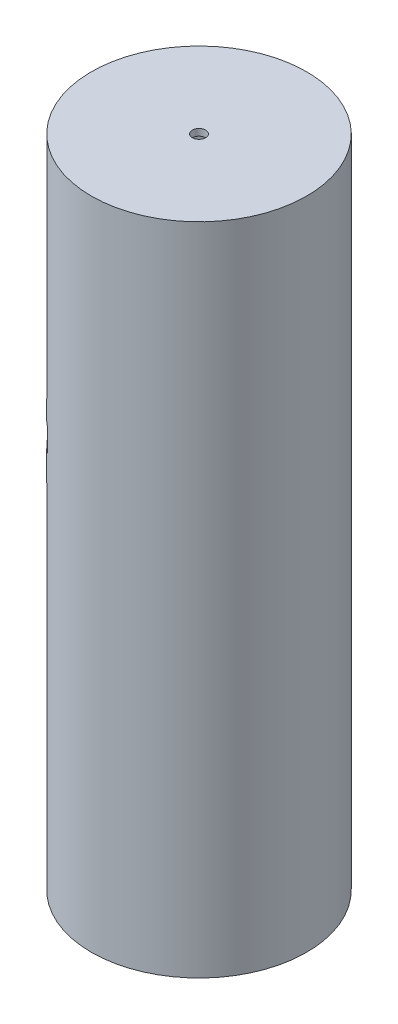
from build123d import *
from build123d.topology import SkipClean

# Parameters (mm, degrees)
SKETCH1_R           = 48.5
SKETCH1_R_2         = 46
BOSS_EXTRUDE1_DEPTH = 295
BOSS_EXTRUDE2_START = -148.568038
SKETCH3_R           = 46
BOSS_EXTRUDE2_DEPTH = 6
CIRPATTERN1_COUNT   = 4
FILLET2_START       = 156.431961757
FILLET2_OUTLINE_R   = 46
FILLET2_DEPTH       = 5.0000001
FILLET2_START_2     = 167.431961857
FILLET2_2_OUTLINE_R = 46
FILLET2_2_DEPTH     = 5.0000001
FILLET2_START_3     = 160.260971941
FILLET2_4_DEPTH     = 8.341979732
FILLET2_START_4     = 161.431961857
FILLET2_5_DEPTH     = 6
SKETCH4_R           = 2.551704147
BOSS_EXTRUDE3_DEPTH = 10
SKETCH5_R           = 1.6
CUT_EXTRUDE1_DEPTH  = 1.6
BOSS_EXTRUDE4_START = -3
SKETCH6_R           = 48.5
BOSS_EXTRUDE4_DEPTH = 3
FILLET3_R           = 10
SKETCH7_R           = 3
CUT_EXTRUDE2_DEPTH  = 3
SKETCH9_W           = 32.917963655
SKETCH9_H           = 10.655653456
CUT_EXTRUDE3_DEPTH  = 22


with BuildPart() as part:
    # Sketch1 → Boss-Extrude1 (new body)
    with BuildSketch(Plane(origin=(0, 15, 0), x_dir=(1, 0, 0), z_dir=(0, 1, 0))):
        with Locations(Location((0, 0, 0), (0, 0, 270))):
            Circle(SKETCH1_R)
        with Locations(Location((0, 0, 0), (0, 0, 270))):
            Circle(SKETCH1_R_2, mode=Mode.SUBTRACT)
    extrude(amount=BOSS_EXTRUDE1_DEPTH)

    # Sketch3 → Boss-Extrude2 (add)
    with BuildSketch(Plane(origin=(0, 310, 0), x_dir=(1, 0, 0), z_dir=(0, 1, 0)).offset(BOSS_EXTRUDE2_START)):
        with Locations(Location((0, 0, 0), (0, 0, 270))):
            Circle(SKETCH3_R)
        with BuildLine():
            Line((-29.674213133, 25.15301941), (-34.621942216, 27.501293009))
            ThreePointArc((-34.621942216, 27.501293009), (39.944695621, -18.958409524), (-43.197423731, 9.433057988))
            Line((-43.197423731, 9.433057988), (-38.249694648, 7.084784388))
            Line((-38.249694648, 7.084784388), (-36.963372421, 9.795019642))
            Line((-36.963372421, 9.795019642), (-42.380223803, 12.3659464))
            ThreePointArc((-42.380223803, 12.3659464), (-41.607558546, 14.758423758), (-40.699952451, 17.103036878))
            Line((-40.699952451, 17.103036878), (-36.002135032, 14.873375465))
            Line((-36.002135032, 14.873375465), (-34.287038729, 18.487022469))
            Line((-34.287038729, 18.487022469), (-38.984856148, 20.716683883))
            ThreePointArc((-38.984856148, 20.716683883), (-37.742324037, 22.902335607), (-36.377386743, 25.013710915))
            Line((-36.377386743, 25.013710915), (-30.960535361, 22.442784157))
            Line((-30.960535361, 22.442784157), (-29.674213133, 25.15301941))
        make_face(mode=Mode.SUBTRACT)
    boss_extrude2 = extrude(amount=BOSS_EXTRUDE2_DEPTH)

    # CirPattern1: Boss-Extrude2 ×4 about axis
    cirpattern1_axis = Axis((0, 0, 0), (0, 1, 0))
    for i in range(1, CIRPATTERN1_COUNT):
        add(boss_extrude2.rotate(cirpattern1_axis, i * 360 / CIRPATTERN1_COUNT))

    # Fillet2: read off the stored shape, not the designer's step
    # Fillet2 outline → Fillet2 (add)
    with BuildSketch(Plane(origin=(0, 0, 0), x_dir=(1, 0, 0), z_dir=(0, 1, 0)).offset(FILLET2_START)):
        Circle(FILLET2_OUTLINE_R)
    extrude(amount=FILLET2_DEPTH)

    # Fillet2 2 outline → Fillet2 2 (add)
    with BuildSketch(Plane(origin=(0, 0, 0), x_dir=(1, 0, 0), z_dir=(0, 1, 0)).offset(FILLET2_START_2)):
        Circle(FILLET2_2_OUTLINE_R)
    extrude(amount=FILLET2_2_DEPTH)

    # Fillet2 3 outline → Fillet2 3 (revolve, cut)
    with BuildSketch(Plane.XY):
        with BuildLine():
            ThreePointArc((46, 156.431961857), (44.535533906, 159.967495763), (41, 161.431961857))
            Line((41, 161.431961857), (41, 167.431961857))
            ThreePointArc((41, 167.431961857), (44.535533906, 168.896427951), (46, 172.431961857))
            Line((46, 172.431961857), (0, 172.431961857))
            Line((0, 172.431961857), (0, 156.431961857))
            Line((0, 156.431961857), (46, 156.431961857))
        make_face()
    revolve(axis=Axis((0, 0, 0), (0, 1, 0)), mode=Mode.SUBTRACT)

    # Fillet2 4 outline → Fillet2 4 (cut)
    with SkipClean():  # the faces are left unmerged after this step: merging them gives an invalid solid
        with BuildSketch(Plane(origin=(0, 0, 0), x_dir=(1, 0, 0), z_dir=(0, 1, 0)).offset(FILLET2_START_3)):
            with BuildLine():
                Line((-38.249694648, 7.084784388), (-43.197423731, 9.433057988))
                ThreePointArc((-43.197423731, 9.433057988), (-41.650785082, -14.839545211), (-27.501293009, -34.621942216))
                Line((-27.501293009, -34.621942216), (-25.15301941, -29.674213133))
                Line((-25.15301941, -29.674213133), (-22.442784157, -30.960535361))
                Line((-22.442784157, -30.960535361), (-25.013710915, -36.377386743))
                ThreePointArc((-25.013710915, -36.377386743), (-22.902335607, -37.742324037), (-20.716683883, -38.984856148))
                Line((-20.716683883, -38.984856148), (-18.487022469, -34.287038729))
                Line((-18.487022469, -34.287038729), (-14.873375465, -36.002135032))
                Line((-14.873375465, -36.002135032), (-17.103036878, -40.699952451))
                ThreePointArc((-17.103036878, -40.699952451), (-14.758423758, -41.607558546), (-12.3659464, -42.380223803))
                Line((-12.3659464, -42.380223803), (-9.795019642, -36.963372421))
                Line((-9.795019642, -36.963372421), (-7.084784388, -38.249694648))
                Line((-7.084784388, -38.249694648), (-9.433057988, -43.197423731))
                ThreePointArc((-9.433057988, -43.197423731), (14.839545211, -41.650785082), (34.621942216, -27.501293009))
                Line((34.621942216, -27.501293009), (29.674213133, -25.15301941))
                Line((29.674213133, -25.15301941), (30.960535361, -22.442784157))
                Line((30.960535361, -22.442784157), (36.377386743, -25.013710915))
                ThreePointArc((36.377386743, -25.013710915), (37.742324037, -22.902335607), (38.984856148, -20.716683883))
                Line((38.984856148, -20.716683883), (34.287038729, -18.487022469))
                Line((34.287038729, -18.487022469), (36.002135032, -14.873375465))
                Line((36.002135032, -14.873375465), (40.699952451, -17.103036878))
                ThreePointArc((40.699952451, -17.103036878), (41.607558546, -14.758423758), (42.380223803, -12.3659464))
                Line((42.380223803, -12.3659464), (36.963372421, -9.795019642))
                Line((36.963372421, -9.795019642), (38.249694648, -7.084784388))
                Line((38.249694648, -7.084784388), (43.197423731, -9.433057988))
                ThreePointArc((43.197423731, -9.433057988), (41.650785082, 14.839545211), (27.501293009, 34.621942216))
                Line((27.501293009, 34.621942216), (25.15301941, 29.674213133))
                Line((25.15301941, 29.674213133), (22.442784157, 30.960535361))
                Line((22.442784157, 30.960535361), (25.013710915, 36.377386743))
                ThreePointArc((25.013710915, 36.377386743), (22.902335607, 37.742324037), (20.716683883, 38.984856148))
                Line((20.716683883, 38.984856148), (18.487022469, 34.287038729))
                Line((18.487022469, 34.287038729), (14.873375465, 36.002135032))
                Line((14.873375465, 36.002135032), (17.103036878, 40.699952451))
                ThreePointArc((17.103036878, 40.699952451), (14.758423758, 41.607558546), (12.3659464, 42.380223803))
                Line((12.3659464, 42.380223803), (9.795019642, 36.963372421))
                Line((9.795019642, 36.963372421), (7.084784388, 38.249694648))
                Line((7.084784388, 38.249694648), (9.433057988, 43.197423731))
                ThreePointArc((9.433057988, 43.197423731), (-14.839545211, 41.650785082), (-34.621942216, 27.501293009))
                Line((-34.621942216, 27.501293009), (-29.674213133, 25.15301941))
                Line((-29.674213133, 25.15301941), (-30.960535361, 22.442784157))
                Line((-30.960535361, 22.442784157), (-36.377386743, 25.013710915))
                ThreePointArc((-36.377386743, 25.013710915), (-37.742324037, 22.902335607), (-38.984856148, 20.716683883))
                Line((-38.984856148, 20.716683883), (-34.287038729, 18.487022469))
                Line((-34.287038729, 18.487022469), (-36.002135032, 14.873375465))
                Line((-36.002135032, 14.873375465), (-40.699952451, 17.103036878))
                ThreePointArc((-40.699952451, 17.103036878), (-41.607558546, 14.758423758), (-42.380223803, 12.3659464))
                Line((-42.380223803, 12.3659464), (-36.963372421, 9.795019642))
                Line((-36.963372421, 9.795019642), (-38.249694648, 7.084784388))
            make_face()
        extrude(amount=FILLET2_4_DEPTH, mode=Mode.SUBTRACT)
    add(part.part.scale(1), mode=Mode.REPLACE)  # the faces are merged on a copy

    # Fillet2 5 outline → Fillet2 5 (add)
    with BuildSketch(Plane(origin=(0, 0, 0), x_dir=(1, 0, 0), z_dir=(0, 1, 0)).offset(FILLET2_START_4)):
        with BuildLine():
            ThreePointArc((-39.497464295, 10.997741324), (-39.88113743, 9.512879546), (-40.209009723, 8.014707548))
            Line((-40.209009723, 8.014707548), (-38.249694648, 7.084784388))
            Line((-38.249694648, 7.084784388), (-36.963372421, 9.795019642))
            Line((-36.963372421, 9.795019642), (-39.497464295, 10.997741324))
        make_face()
        with BuildLine():
            Line((-25.15301941, -29.674213133), (-26.08294257, -31.633528208))
            ThreePointArc((-26.08294257, -31.633528208), (-24.88163113, -32.586875154), (-23.645505839, -33.494627235))
            Line((-23.645505839, -33.494627235), (-22.442784157, -30.960535361))
            Line((-22.442784157, -30.960535361), (-25.15301941, -29.674213133))
        make_face()
        with BuildLine():
            ThreePointArc((-36.138238529, 19.365632342), (-37.039881794, 17.579737105), (-37.853334832, 15.751985337))
            Line((-37.853334832, 15.751985337), (-36.002135032, 14.873375465))
            Line((-36.002135032, 14.873375465), (-34.287038729, 18.487022469))
            Line((-34.287038729, 18.487022469), (-36.138238529, 19.365632342))
        make_face()
        with BuildLine():
            Line((-18.487022469, -34.287038729), (-19.365632342, -36.138238529))
            ThreePointArc((-19.365632342, -36.138238529), (-17.579737105, -37.039881794), (-15.751985337, -37.853334832))
            Line((-15.751985337, -37.853334832), (-14.873375465, -36.002135032))
            Line((-14.873375465, -36.002135032), (-18.487022469, -34.287038729))
        make_face()
        with BuildLine():
            ThreePointArc((-31.633528208, 26.08294257), (-32.586875154, 24.88163113), (-33.494627235, 23.645505839))
            Line((-33.494627235, 23.645505839), (-30.960535361, 22.442784157))
            Line((-30.960535361, 22.442784157), (-29.674213133, 25.15301941))
            Line((-29.674213133, 25.15301941), (-31.633528208, 26.08294257))
        make_face()
        with BuildLine():
            Line((-9.795019642, -36.963372421), (-10.997741324, -39.497464295))
            ThreePointArc((-10.997741324, -39.497464295), (-9.512879546, -39.88113743), (-8.014707548, -40.209009723))
            Line((-8.014707548, -40.209009723), (-7.084784388, -38.249694648))
            Line((-7.084784388, -38.249694648), (-9.795019642, -36.963372421))
        make_face()
        with BuildLine():
            ThreePointArc((10.997741324, 39.497464295), (9.512879546, 39.88113743), (8.014707548, 40.209009723))
            Line((8.014707548, 40.209009723), (7.084784388, 38.249694648))
            Line((7.084784388, 38.249694648), (9.795019642, 36.963372421))
            Line((9.795019642, 36.963372421), (10.997741324, 39.497464295))
        make_face()
        with BuildLine():
            Line((29.674213133, -25.15301941), (31.633528208, -26.08294257))
            ThreePointArc((31.633528208, -26.08294257), (32.586875154, -24.88163113), (33.494627235, -23.645505839))
            Line((33.494627235, -23.645505839), (30.960535361, -22.442784157))
            Line((30.960535361, -22.442784157), (29.674213133, -25.15301941))
        make_face()
        with BuildLine():
            ThreePointArc((19.365632342, 36.138238529), (17.579737105, 37.039881794), (15.751985337, 37.853334832))
            Line((15.751985337, 37.853334832), (14.873375465, 36.002135032))
            Line((14.873375465, 36.002135032), (18.487022469, 34.287038729))
            Line((18.487022469, 34.287038729), (19.365632342, 36.138238529))
        make_face()
        with BuildLine():
            Line((34.287038729, -18.487022469), (36.138238529, -19.365632342))
            ThreePointArc((36.138238529, -19.365632342), (37.039881794, -17.579737105), (37.853334832, -15.751985337))
            Line((37.853334832, -15.751985337), (36.002135032, -14.873375465))
            Line((36.002135032, -14.873375465), (34.287038729, -18.487022469))
        make_face()
        with BuildLine():
            ThreePointArc((26.08294257, 31.633528208), (24.88163113, 32.586875154), (23.645505839, 33.494627235))
            Line((23.645505839, 33.494627235), (22.442784157, 30.960535361))
            Line((22.442784157, 30.960535361), (25.15301941, 29.674213133))
            Line((25.15301941, 29.674213133), (26.08294257, 31.633528208))
        make_face()
        with BuildLine():
            Line((36.963372421, -9.795019642), (39.497464295, -10.997741324))
            ThreePointArc((39.497464295, -10.997741324), (39.88113743, -9.512879546), (40.209009723, -8.014707548))
            Line((40.209009723, -8.014707548), (38.249694648, -7.084784388))
            Line((38.249694648, -7.084784388), (36.963372421, -9.795019642))
        make_face()
    extrude(amount=FILLET2_5_DEPTH)

    # Sketch4 → Boss-Extrude3 (add)
    with BuildSketch(Plane.XZ.offset(-15)):
        with Locations((41.473811215, 19.684152935)):
            Circle(SKETCH4_R)
        with Locations((19.684152935, -41.473811215)):
            Circle(SKETCH4_R)
        with Locations((-19.684152935, 41.473811215)):
            Circle(SKETCH4_R)
        with Locations((-41.473811215, -19.684152935)):
            Circle(SKETCH4_R)
    extrude(amount=-BOSS_EXTRUDE3_DEPTH)

    # Sketch5 → Cut-Extrude1 (cut)
    with BuildSketch(Plane.XZ.offset(-15)):
        with Locations(Location((-19.723607484, 41.556940549, 0), (0, 0, 270))):
            Circle(SKETCH5_R)
        with Locations(Location((41.556940549, 19.723607484, 0), (0, 0, 270))):
            Circle(SKETCH5_R)
        with Locations(Location((19.723607484, -41.556940549, 0), (0, 0, 270))):
            Circle(SKETCH5_R)
        with Locations(Location((-41.556940549, -19.723607484, 0), (0, 0, 270))):
            Circle(SKETCH5_R)
    extrude(amount=-CUT_EXTRUDE1_DEPTH, mode=Mode.SUBTRACT)

    # Sketch6 → Boss-Extrude4 (add)
    with BuildSketch(Plane(origin=(0, 310, 0), x_dir=(1, 0, 0), z_dir=(0, 1, 0)).offset(BOSS_EXTRUDE4_START)):
        with Locations(Location((0, 0, 0), (0, 0, 270))):
            Circle(SKETCH6_R)
    extrude(amount=BOSS_EXTRUDE4_DEPTH)

    # Fillet3
    fillet3_edges = [part.edges().sort_by_distance(p)[0] for p in [
        (0, 307, -46),
    ]]
    fillet(fillet3_edges, radius=FILLET3_R)

    # Sketch7 → Cut-Extrude2 (cut)
    with SkipClean():  # the faces are left unmerged after this step: merging them gives an invalid solid
        with BuildSketch(Plane(origin=(0, 310, 0), x_dir=(1, 0, 0), z_dir=(0, 1, 0))):
            with Locations(Location((0, 0, 0), (0, 0, 270))):
                Circle(SKETCH7_R)
        extrude(amount=-CUT_EXTRUDE2_DEPTH, mode=Mode.SUBTRACT)

    # Sketch9 → Cut-Extrude3 (cut)
    with SkipClean():  # the faces are left unmerged after this step: merging them gives an invalid solid
        with BuildSketch(Plane(origin=(-28.194318625, 5, 20.192753602), x_dir=(-0.5822679243142227, 0, -0.8129969645175844), z_dir=(0.8129969645175844, 0, -0.5822679243142227))):
            with Locations((3.068682605, 188.130853463)):
                Rectangle(SKETCH9_W, SKETCH9_H)
        extrude(amount=-CUT_EXTRUDE3_DEPTH, mode=Mode.SUBTRACT)


solid = part.part
